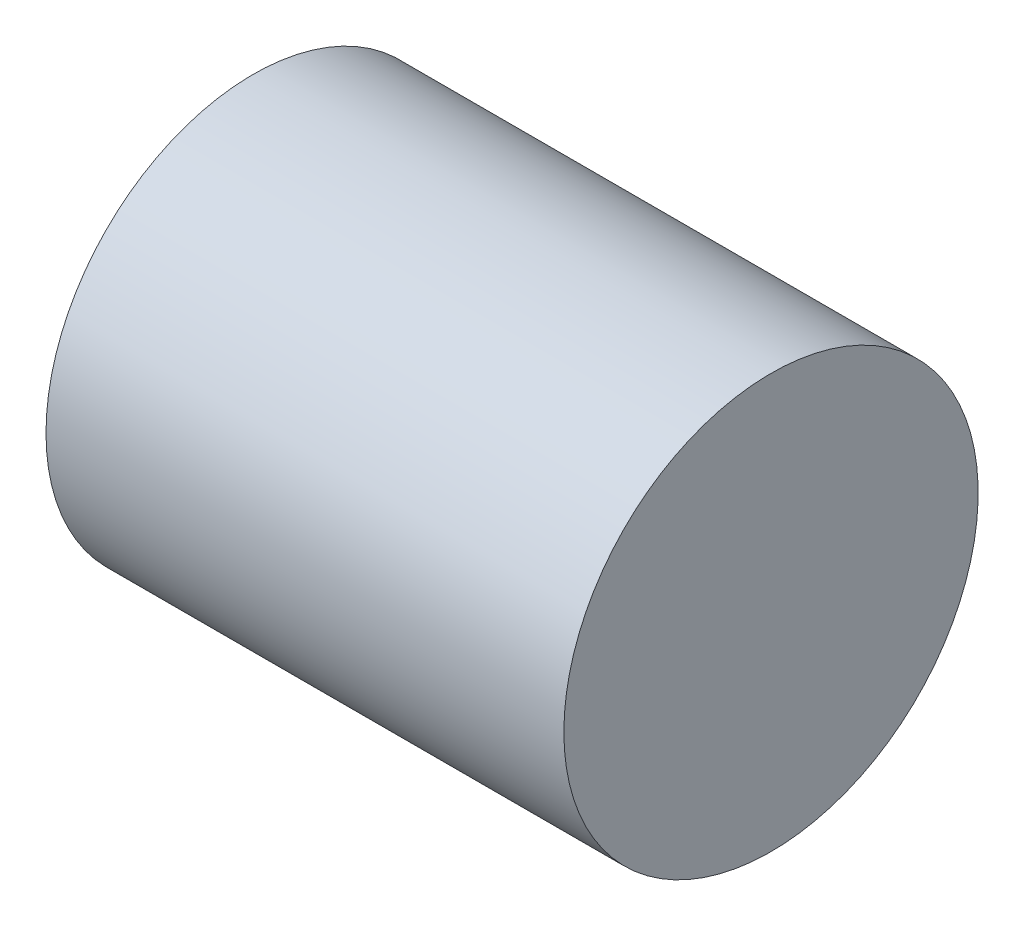
from build123d import *

# Parameters (mm, degrees)
SKETCH1_R           = 4
BOSS_EXTRUDE1_DEPTH = 10


# Read off the part's stored shape, not the designer's step: Surface-Imported1
with BuildPart() as part:
    # Sketch1 → Boss-Extrude1 (new body)
    with BuildSketch(Plane.ZY):
        Circle(SKETCH1_R)
    extrude(amount=-BOSS_EXTRUDE1_DEPTH)


solid = part.part
